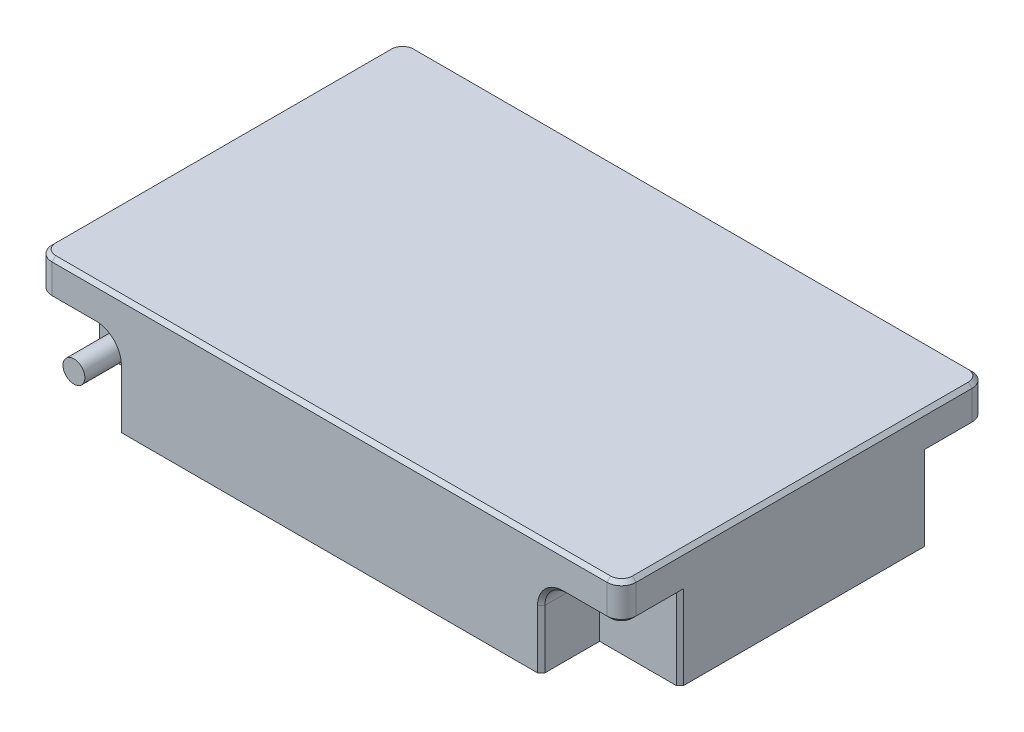
from build123d import *

# Parameters (mm, degrees)
SKETCH1_W            = 800
SKETCH1_H            = 500
BOSS_EXTRUDE1_DEPTH  = 160
SKETCH3_W            = 110
SKETCH3_H            = 110
CUT_EXTRUDE1_DEPTH   = 80
FILLET1_R            = 30
FILLET1_OF_MIRROR1_R = 30
MIRROR2_START        = -250
MIRROR2_DEPTH        = 80
SHELL2_START         = -240
SHELL2_DEPTH         = 480
SHELL2_START_2       = -160
SHELL2_2_DEPTH       = 320
FILLET2_R            = 20
CHAMFER1_SIZE        = 5
CHAMFER2_SIZE        = 5
SKETCH7_R            = 15
BOSS_EXTRUDE2_DEPTH  = 80
SKETCH8_R            = 15
CUT_EXTRUDE2_DEPTH   = 20


# Read off the part's stored shape, not the designer's step: Mirror2, Shell2
with BuildPart() as part:
    # Sketch1 → Boss-Extrude1 (new body)
    with BuildSketch(Plane(origin=(0, 0, 0), x_dir=(1, 0, 0), z_dir=(0, 1, 0))):
        Rectangle(SKETCH1_W, SKETCH1_H)
    extrude(amount=BOSS_EXTRUDE1_DEPTH)

    # Sketch3 → Cut-Extrude1 (cut)
    with BuildSketch(Plane.XY.offset(250)):
        with Locations((-345, 55)):
            Rectangle(SKETCH3_W, SKETCH3_H)
    cut_extrude1 = extrude(amount=-CUT_EXTRUDE1_DEPTH, mode=Mode.SUBTRACT)

    # Fillet1
    fillet1_edges = [part.edges().sort_by_distance(p)[0] for p in [
        (-290, 110, 210),
    ]]
    fillet(fillet1_edges, radius=FILLET1_R)

    # Mirror1: Cut-Extrude1 across plane
    add(cut_extrude1.mirror(Plane(origin=(0, 0, 0), x_dir=(0, 0, 1), z_dir=(1, 0, 0))), mode=Mode.SUBTRACT)

    # Fillet1 of Mirror1
    fillet1_of_mirror1_edges = [part.edges().sort_by_distance(p)[0] for p in [
        (290, 110, 210),
    ]]
    fillet(fillet1_of_mirror1_edges, radius=FILLET1_OF_MIRROR1_R)

    # Mirror2 outline → Mirror2 (cut)
    with BuildSketch(Plane.XY.offset(MIRROR2_START)):
        with BuildLine():
            Line((400, 0), (400, 110))
            Line((400, 110), (320, 110))
            ThreePointArc((320, 110), (298.786796564, 101.213203436), (290, 80))
            Line((290, 80), (290, 0))
            Line((290, 0), (400, 0))
        make_face()
        with BuildLine():
            Line((-400, 0), (-290, 0))
            Line((-290, 0), (-290, 80))
            ThreePointArc((-290, 80), (-298.786796564, 101.213203436), (-320, 110))
            Line((-320, 110), (-400, 110))
            Line((-400, 110), (-400, 0))
        make_face()
    extrude(amount=MIRROR2_DEPTH, mode=Mode.SUBTRACT)

    # Shell2 outline → Shell2 (cut)
    with BuildSketch(Plane.XY.offset(SHELL2_START)):
        with BuildLine():
            Line((-280, 10), (280, 10))
            Line((280, 10), (280, 80))
            ThreePointArc((280, 80), (291.715728753, 108.284271247), (320, 120))
            Line((320, 120), (390, 120))
            Line((390, 120), (390, 150))
            Line((390, 150), (-390, 150))
            Line((-390, 150), (-390, 120))
            Line((-390, 120), (-320, 120))
            ThreePointArc((-320, 120), (-291.715728753, 108.284271247), (-280, 80))
            Line((-280, 80), (-280, 10))
        make_face()
    extrude(amount=SHELL2_DEPTH, mode=Mode.SUBTRACT)

    # Shell2 2 outline → Shell2 2 (cut)
    with BuildSketch(Plane.XY.offset(SHELL2_START_2)):
        with BuildLine():
            Line((280, 10), (390, 10))
            Line((390, 10), (390, 120))
            Line((390, 120), (320, 120))
            ThreePointArc((320, 120), (291.715728753, 108.284271247), (280, 80))
            Line((280, 80), (280, 10))
        make_face()
        with BuildLine():
            Line((-390, 10), (-280, 10))
            Line((-280, 10), (-280, 80))
            ThreePointArc((-280, 80), (-291.715728753, 108.284271247), (-320, 120))
            Line((-320, 120), (-390, 120))
            Line((-390, 120), (-390, 10))
        make_face()
    extrude(amount=SHELL2_2_DEPTH, mode=Mode.SUBTRACT)

    # Fillet2
    fillet2_edges = [part.edges().sort_by_distance(p)[0] for p in [
        (400, 135, 250),
        (-400, 135, 250),
        (-400, 135, -250),
        (400, 135, -250),
    ]]
    fillet(fillet2_edges, radius=FILLET2_R)

    # Chamfer1
    chamfer1_edges = [part.edges().sort_by_distance(p)[0] for p in [
        (-394.142135624, 110, 244.142135624),
        (394.142135624, 110, 244.142135624),
        (394.142135624, 110, -244.142135624),
        (-394.142135624, 110, -244.142135624),
        (-400, 55, 170),
        (-400, 110, 200),
        (-290, 40, 250),
        (-350, 110, 250),
        (-298.786796564, 101.213203436, 250),
        (400, 110, 200),
        (290, 40, 250),
        (400, 55, 170),
        (350, 110, 250),
        (298.786796564, 101.213203436, 250),
        (400, 55, -170),
        (400, 110, -200),
        (290, 40, -250),
        (350, 110, -250),
        (298.786796564, 101.213203436, -250),
        (-400, 110, -200),
        (-290, 40, -250),
        (-400, 55, -170),
        (-350, 110, -250),
        (-298.786796564, 101.213203436, -250),
    ]]
    chamfer(chamfer1_edges, length=CHAMFER1_SIZE)

    # Chamfer2
    chamfer2_edges = [part.edges().sort_by_distance(p)[0] for p in [
        (0, 160, 250),
        (-400, 160, 0),
        (400, 160, 0),
        (0, 160, -250),
        (-394.142135624, 160, -244.142135624),
        (394.142135624, 160, -244.142135624),
        (394.142135624, 160, 244.142135624),
        (-394.142135624, 160, 244.142135624),
    ]]
    chamfer(chamfer2_edges, length=CHAMFER2_SIZE)

    # Sketch7 → Boss-Extrude2 (add)
    with BuildSketch(Plane.XY.offset(170)):
        with Locations(Location((-350, 40, 0), (0, 0, 180))):
            Circle(SKETCH7_R)
    boss_extrude2 = extrude(amount=BOSS_EXTRUDE2_DEPTH)

    # Mirror3: Boss-Extrude2 across plane
    add(boss_extrude2.mirror(Plane.XY))

    # Sketch8 → Cut-Extrude2 (cut)
    with BuildSketch(Plane.XZ.offset(-110)):
        with Locations(Location((360, 200, 0), (0, 0, 270))):
            Circle(SKETCH8_R)
    cut_extrude2 = extrude(amount=-CUT_EXTRUDE2_DEPTH, mode=Mode.SUBTRACT)

    # Mirror4: Cut-Extrude2 across plane
    add(cut_extrude2.mirror(Plane.XY), mode=Mode.SUBTRACT)


solid = part.part
